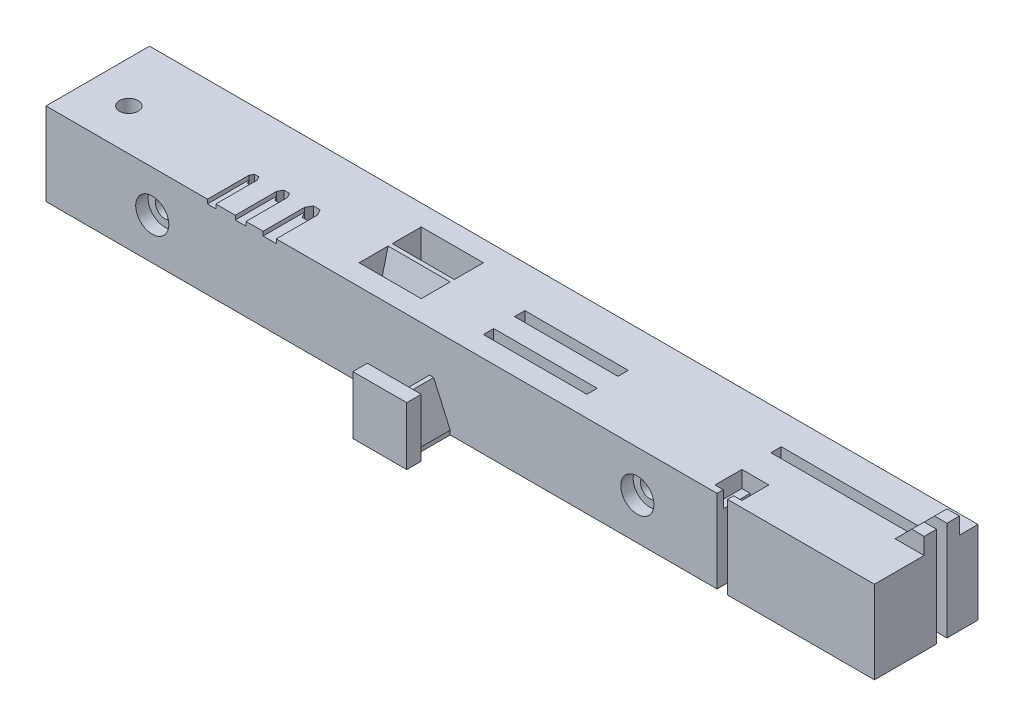
from build123d import *

# Parameters (mm, degrees)
SCHIZZO1_W                    = 200
SCHIZZO1_H                    = 20
ESTRUSIONE_ESTRUSIONE1_DEPTH  = 25
SCHIZZO2_R                    = 2.25
TAGLIO_ESTRUSIONE1_DEPTH      = 141.400046302
SCHIZZO4_W                    = 2.020725942
SCHIZZO4_H                    = 10
SCHIZZO4_W_2                  = 2.598076211
SCHIZZO4_W_3                  = 3.175426481
TAGLIO_ESTRUSIONE2_DEPTH      = 1
SCHIZZO7_W                    = 15
SCHIZZO7_H                    = 5.5
TAGLIO_ESTRUSIONE3_DEPTH      = 141.400046302
SMUSSO1_SIZE                  = 1.5
SMUSSO1_SIZE2                 = 6
SCHIZZO8_W                    = 25
SCHIZZO8_H                    = 2.5
TAGLIO_ESTRUSIONE4_DEPTH      = 13
SCHIZZO9_W                    = 40
SCHIZZO9_H                    = 2.5
TAGLIO_ESTRUSIONE5_DEPTH      = 141.400046302
SCHIZZO10_W                   = 7
SCHIZZO10_H                   = 3
ESTRUSIONE_ESTRUSIONE5_DEPTH  = 4
SMUSSO2_SIZE                  = 4
SCHIZZO11_W                   = 2.5
SCHIZZO11_H                   = 8
TAGLIO_ESTRUSIONE6_DEPTH      = 141.400046302
SCHIZZO12_W                   = 6.5
SCHIZZO12_H                   = 6.5
TAGLIO_ESTRUSIONE7_DEPTH      = 4
SCHIZZO13_W                   = 9
SCHIZZO13_H                   = 10
ESTRUSIONE_ESTRUSIONE9_DEPTH  = 9
SCHIZZO14_W                   = 13
SCHIZZO14_H                   = 14
ESTRUSIONE_ESTRUSIONE10_DEPTH = 3.5
SMUSSO3_SIZE                  = 9
SMUSSO3_SIZE2                 = 4
SMUSSO4_SIZE                  = 4
SMUSSO4_SIZE2                 = 9
SCHIZZO16_R                   = 2.25
TAGLIO_ESTRUSIONE8_DEPTH      = 141.17038757
SCHIZZO17_R                   = 4
TAGLIO_ESTRUSIONE9_DEPTH      = 3


with BuildPart() as part:
    # Schizzo1 → Estrusione-Estrusione1 (new body)
    with BuildSketch(Plane.XY):
        with Locations((36.701035116, 4.318421053)):
            Rectangle(SCHIZZO1_W, SCHIZZO1_H)
    extrude(amount=ESTRUSIONE_ESTRUSIONE1_DEPTH)

    # Schizzo2 → Taglio-Estrusione1 (cut, through all)
    with BuildSketch(Plane(origin=(0, 14.318421053, 0), x_dir=(1, 0, 0), z_dir=(0, 1, 0))):
        with Locations(Location((-53.298964884, -15, 0), (0, 0, 270))):
            Circle(SCHIZZO2_R)
        Polygon((-23.80414637, -15.875), (-22.793783399, -15.875), (-22.288601913, -15), (-22.793783399, -14.125), (-23.80414637, -14.125), (-24.309327855, -15), align=None)
        Polygon((-14.999926779, -15), (-15.649445831, -13.875), (-16.948483937, -13.875), (-17.59800299, -15), (-16.948483937, -16.125), (-15.649445831, -16.125), align=None)
        Polygon((-8.505108264, -16.375), (-7.711251644, -15), (-8.505108264, -13.625), (-10.092821504, -13.625), (-10.886678125, -15), (-10.092821504, -16.375), align=None)
    extrude(amount=-TAGLIO_ESTRUSIONE1_DEPTH, mode=Mode.SUBTRACT)

    # Schizzo4 → Taglio-Estrusione2 (cut)
    with BuildSketch(Plane(origin=(0, 14.318421053, 0), x_dir=(1, 0, 0), z_dir=(0, 1, 0))):
        with Locations((-23.298964884, -20)):
            Rectangle(SCHIZZO4_W, SCHIZZO4_H)
        with Locations((-16.298964885, -20)):
            Rectangle(SCHIZZO4_W_2, SCHIZZO4_H)
        with Locations((-9.298964885, -20)):
            Rectangle(SCHIZZO4_W_3, SCHIZZO4_H)
    extrude(amount=-TAGLIO_ESTRUSIONE2_DEPTH, mode=Mode.SUBTRACT)

    # Schizzo7 → Taglio-Estrusione3 (cut, through all)
    with BuildSketch(Plane(origin=(0, 14.318421053, 0), x_dir=(1, 0, 0), z_dir=(0, 1, 0))):
        with Locations((14.788748356, -17.25)):
            Rectangle(SCHIZZO7_W, SCHIZZO7_H)
        with Locations((14.788748356, -7.75)):
            Rectangle(SCHIZZO7_W, SCHIZZO7_H)
    extrude(amount=-TAGLIO_ESTRUSIONE3_DEPTH, mode=Mode.SUBTRACT)

    # Smusso1
    smusso1_edges = [part.edges().sort_by_distance(p)[0] for p in [
        (14.788748356, 14.318421053, 14.5),
        (14.788748356, 14.318421053, 10.5),
    ]]
    smusso1_side = [part.faces().sort_by_distance(p)[0] for p in [
        (38.695689024, 14.318421053, 12.36530447),
    ]]
    chamfer(smusso1_edges, length=SMUSSO1_SIZE, length2=SMUSSO1_SIZE2, reference=smusso1_side[0])

    # Schizzo8 → Taglio-Estrusione4 (cut)
    with BuildSketch(Plane(origin=(0, 14.318421053, 0), x_dir=(1, 0, 0), z_dir=(0, 1, 0))):
        with Locations((49.788748356, -18.75)):
            Rectangle(SCHIZZO8_W, SCHIZZO8_H)
        with Locations((49.788748356, -11.25)):
            Rectangle(SCHIZZO8_W, SCHIZZO8_H)
    extrude(amount=-TAGLIO_ESTRUSIONE4_DEPTH, mode=Mode.SUBTRACT)

    # Schizzo9 → Taglio-Estrusione5 (cut, through all)
    with BuildSketch(Plane(origin=(0, 14.318421053, 0), x_dir=(1, 0, 0), z_dir=(0, 1, 0))):
        with Locations((116.701035116, -8.75)):
            Rectangle(SCHIZZO9_W, SCHIZZO9_H)
    extrude(amount=-TAGLIO_ESTRUSIONE5_DEPTH, mode=Mode.SUBTRACT)

    # Schizzo10 → Estrusione-Estrusione5 (add)
    with BuildSketch(Plane(origin=(0, 14.318421053, 0), x_dir=(1, 0, 0), z_dir=(0, 1, 0))):
        with Locations((133.201035116, -6)):
            Rectangle(SCHIZZO10_W, SCHIZZO10_H)
        with Locations((133.201035116, -11.5)):
            Rectangle(SCHIZZO10_W, SCHIZZO10_H)
    extrude(amount=ESTRUSIONE_ESTRUSIONE5_DEPTH)

    # Smusso2
    smusso2_edges = [part.edges().sort_by_distance(p)[0] for p in [
        (129.701035116, 18.318421053, 11.5),
        (129.701035116, 18.318421053, 6),
    ]]
    chamfer(smusso2_edges, length=SMUSSO2_SIZE - 0.0001)  # a hair under: the kernel refuses the full size

    # Schizzo11 → Taglio-Estrusione6 (cut, through all)
    with BuildSketch(Plane(origin=(0, 14.318421053, 0), x_dir=(1, 0, 0), z_dir=(0, 1, 0))):
        with Locations((99.951035116, -21)):
            Rectangle(SCHIZZO11_W, SCHIZZO11_H)
    extrude(amount=-TAGLIO_ESTRUSIONE6_DEPTH, mode=Mode.SUBTRACT)

    # Schizzo12 → Taglio-Estrusione7 (cut)
    with BuildSketch(Plane(origin=(0, 14.318421053, 0), x_dir=(1, 0, 0), z_dir=(0, 1, 0))):
        with Locations((99.951035116, -20.25)):
            Rectangle(SCHIZZO12_W, SCHIZZO12_H)
    extrude(amount=-TAGLIO_ESTRUSIONE7_DEPTH, mode=Mode.SUBTRACT)

    # Schizzo13 → Estrusione-Estrusione9 (add)
    with BuildSketch(Plane.XY.offset(25)):
        with Locations((29.788748356, -0.681578947)):
            Rectangle(SCHIZZO13_W, SCHIZZO13_H)
    extrude(amount=ESTRUSIONE_ESTRUSIONE9_DEPTH)

    # Schizzo14 → Estrusione-Estrusione10 (add)
    with BuildSketch(Plane.XY.offset(34)):
        with Locations((29.788748356, 1.318421053)):
            Rectangle(SCHIZZO14_W, SCHIZZO14_H)
    extrude(amount=ESTRUSIONE_ESTRUSIONE10_DEPTH)

    # Smusso3
    smusso3_edges = [part.edges().sort_by_distance(p)[0] for p in [
        (34.288748356, 4.318421053, 29.5),
    ]]
    smusso3_side = [part.faces().sort_by_distance(p)[0] for p in [
        (34.288748356, -0.681578947, 29.5),
    ]]
    chamfer(smusso3_edges, length=SMUSSO3_SIZE, length2=SMUSSO3_SIZE2, reference=smusso3_side[0])

    # Smusso4
    smusso4_edges = [part.edges().sort_by_distance(p)[0] for p in [
        (25.288748356, 4.318421053, 29.5),
    ]]
    smusso4_side = [part.faces().sort_by_distance(p)[0] for p in [
        (27.788748356, 4.318421053, 29.5),
    ]]
    chamfer(smusso4_edges, length=SMUSSO4_SIZE, length2=SMUSSO4_SIZE2, reference=smusso4_side[0])

    # Schizzo16 → Taglio-Estrusione8 (cut, through all)
    with BuildSketch(Plane.XY.offset(25)):
        with Locations((-37.648964884, 4.318421053)):
            Circle(SCHIZZO16_R)
        with Locations((79.451035116, 4.318421053)):
            Circle(SCHIZZO16_R)
    extrude(amount=-TAGLIO_ESTRUSIONE8_DEPTH, mode=Mode.SUBTRACT)

    # Schizzo17 → Taglio-Estrusione9 (cut)
    with BuildSketch(Plane.XY.offset(25)):
        with Locations((-37.648964884, 4.318421053)):
            Circle(SCHIZZO17_R)
        with Locations((79.451035116, 4.318421053)):
            Circle(SCHIZZO17_R)
    extrude(amount=-TAGLIO_ESTRUSIONE9_DEPTH, mode=Mode.SUBTRACT)


solid = part.part
